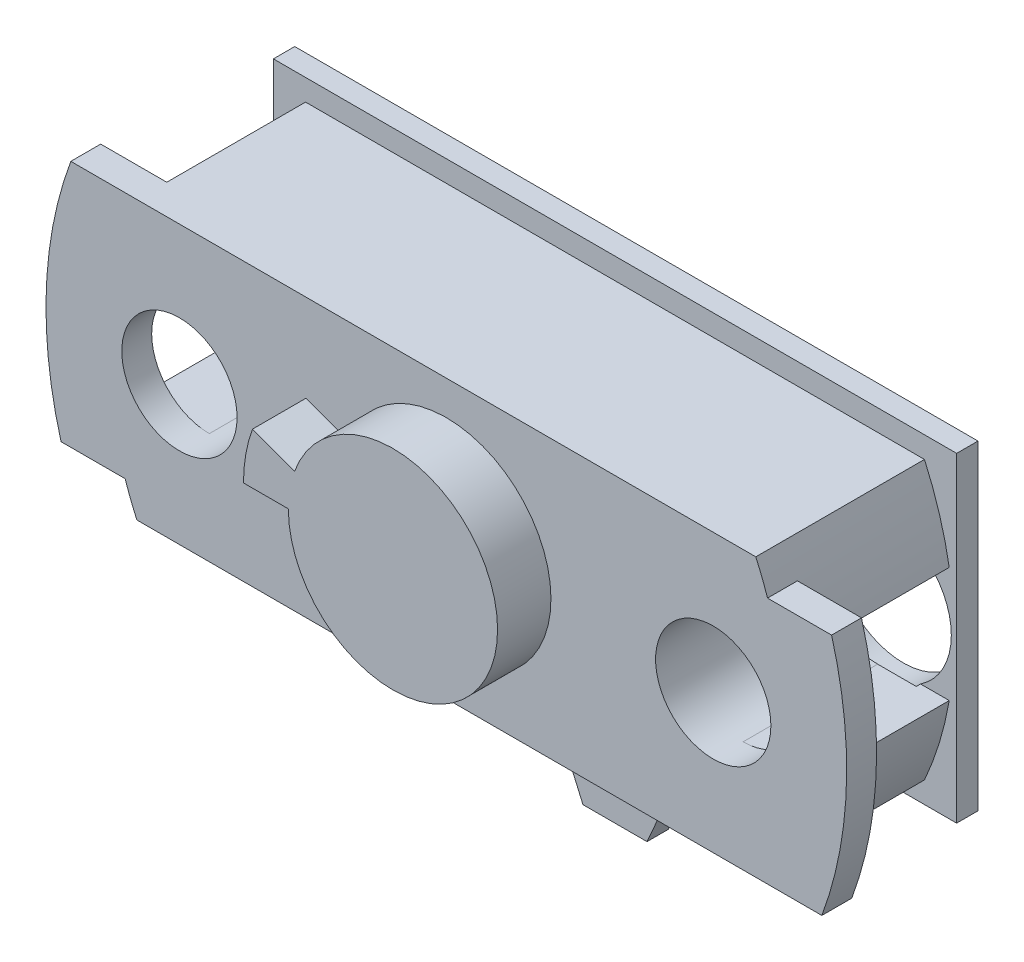
from build123d import *

# Parameters (mm, degrees)
P_IDAT_VYSUNUT_M1_DEPTH  = 1.4
P_IDAT_VYSUNUT_M2_DEPTH  = 2.5
SKICA3_R                 = 2.7
ODEBRAT_VYSUNUT_M1_DEPTH = 2.5
P_IDAT_VYSUNUT_M3_DEPTH  = 7.5
ODEBRAT_START            = -7.5
ODEBRAT_VYSUNUT_M2_DEPTH = 7.5
SKICA9_W                 = 32
SKICA9_H                 = 15
P_IDAT_VYSUNUT_M5_DEPTH  = 1
SKICA6_R                 = 3.25
ODEBRAT_VYSUNUT_M3_DEPTH = 1.2
SKICA7_R                 = 0.95
ODEBRAT_VYSUNUT_M5_DEPTH = 7
P_IDAT_VYSUNUT_M7_DEPTH  = 1


with BuildPart() as part:
    # Skica1 → Přidat vysunutím1 (new body)
    with BuildSketch(Plane.XY):
        with BuildLine():
            ThreePointArc((-17.587282337, 6.5), (-18.735542789, 0.736163289), (-18.043073463, -5.1))
            Line((-18.043073463, -5.1), (-15.043073463, -5.1))
            Line((-15.043073463, -5.1), (-15.043073463, -6.5))
            Line((-15.043073463, -6.5), (17.587282337, -6.5))
            ThreePointArc((17.587282337, -6.5), (18.735542789, -0.736163289), (18.043073463, 5.1))
            Line((18.043073463, 5.1), (15.043073463, 5.1))
            Line((15.043073463, 5.1), (15.043073463, 6.5))
            Line((15.043073463, 6.5), (-17.587282337, 6.5))
        make_face()
    extrude(amount=P_IDAT_VYSUNUT_M1_DEPTH)

    # Skica2 → Přidat vysunutím2 (add)
    with BuildSketch(Plane.XY.offset(1.4)):
        with BuildLine():
            ThreePointArc((-4.9, 0), (4.82555799, -0.850876071), (-4.604493842, 1.675898702))
            Line((-4.604493842, 1.675898702), (-6.577848346, 2.394141003))
            ThreePointArc((-6.577848346, 2.394141003), (-6.893654271, 1.215537244), (-7, 0))
            Line((-7, 0), (-4.9, 0))
        make_face()
    extrude(amount=P_IDAT_VYSUNUT_M2_DEPTH)

    # Skica3 → Odebrat vysunutím1 (cut)
    with BuildSketch(Plane.XY.offset(1.4)):
        with Locations((-12.5, 0)):
            Circle(SKICA3_R)
        with Locations((12.5, 0)):
            Circle(SKICA3_R)
    extrude(amount=-ODEBRAT_VYSUNUT_M1_DEPTH, mode=Mode.SUBTRACT)

    # Skica4 → Přidat vysunutím3 (add)
    with BuildSketch(Plane(origin=(0, 0, 0), x_dir=(-1, 0, 0), z_dir=(0, 0, -1))):
        with BuildLine():
            Line((14.493241846, 6.5), (-14.493241846, 6.5))
            ThreePointArc((-14.493241846, 6.5), (-15.192361337, 4.636401214), (-15.652924941, 2.7))
            Line((-15.652924941, 2.7), (-12.5, 2.7))
            ThreePointArc((-12.5, 2.7), (-10.590811691, 1.909188309), (-9.8, 0))
            ThreePointArc((-9.8, 0), (-10.590811691, -1.909188309), (-12.5, -2.7))
            Line((-12.5, -2.7), (-15.652924941, -2.7))
            ThreePointArc((-15.652924941, -2.7), (-15.192361337, -4.636401214), (-14.493241846, -6.5))
            Line((-14.493241846, -6.5), (14.493241846, -6.5))
            ThreePointArc((14.493241846, -6.5), (15.192361337, -4.636401214), (15.652924941, -2.7))
            Line((15.652924941, -2.7), (12.5, -2.7))
            ThreePointArc((12.5, -2.7), (9.8, 0), (12.5, 2.7))
            Line((12.5, 2.7), (15.652924941, 2.7))
            ThreePointArc((15.652924941, 2.7), (15.192361337, 4.636401214), (14.493241846, 6.5))
        make_face()
    extrude(amount=P_IDAT_VYSUNUT_M3_DEPTH)

    # Skica5 → Odebrat vysunutím2 (cut)
    with BuildSketch(Plane(origin=(0, 0, 0), x_dir=(-1, 0, 0), z_dir=(0, 0, -1)).offset(ODEBRAT_START)):
        with BuildLine():
            ThreePointArc((-15.043073463, 5.1), (-14.784738094, 5.80651175), (-14.493241846, 6.5))
            Line((-14.493241846, 6.5), (-15.043073463, 6.5))
            Line((-15.043073463, 6.5), (-15.043073463, 5.1))
        make_face()
        with BuildLine():
            Line((15.043073463, -6.5), (15.043073463, -5.1))
            ThreePointArc((15.043073463, -5.1), (14.784738094, -5.80651175), (14.493241846, -6.5))
            Line((14.493241846, -6.5), (15.043073463, -6.5))
        make_face()
    extrude(amount=ODEBRAT_VYSUNUT_M2_DEPTH, mode=Mode.SUBTRACT)

    # Skica9 → Přidat vysunutím5 (add)
    with BuildSketch(Plane(origin=(0, 0, -7.5), x_dir=(-1, 0, 0), z_dir=(0, 0, -1))):
        Rectangle(SKICA9_W, SKICA9_H)
    extrude(amount=-P_IDAT_VYSUNUT_M5_DEPTH)

    # Skica6 → Odebrat vysunutím3 (cut)
    with BuildSketch(Plane(origin=(0, 0, -7.5), x_dir=(-1, 0, 0), z_dir=(0, 0, -1))):
        with Locations((-12.5, 0)):
            Circle(SKICA6_R)
        with Locations((12.5, 0)):
            Circle(SKICA6_R)
    extrude(amount=-ODEBRAT_VYSUNUT_M3_DEPTH, mode=Mode.SUBTRACT)

    # Skica7 → Odebrat vysunutím5 (cut)
    with BuildSketch(Plane(origin=(0, 0, -7.5), x_dir=(-1, 0, 0), z_dir=(0, 0, -1))):
        with Locations((10.083296, 4.829031143)):
            Circle(SKICA7_R)
        with Locations((-10.083296, -4.829031143)):
            Circle(SKICA7_R)
    extrude(amount=-ODEBRAT_VYSUNUT_M5_DEPTH, mode=Mode.SUBTRACT)

    # Skica12 → Přidat vysunutím7 (add)
    with BuildSketch(Plane(origin=(0, 0, -7.5), x_dir=(-1, 0, 0), z_dir=(0, 0, -1))):
        Polygon((-5, -7.5), (-1.5, -15.5), (1.5, -15.5), (5, -7.5), align=None)
    extrude(amount=-P_IDAT_VYSUNUT_M7_DEPTH)


solid = part.part
